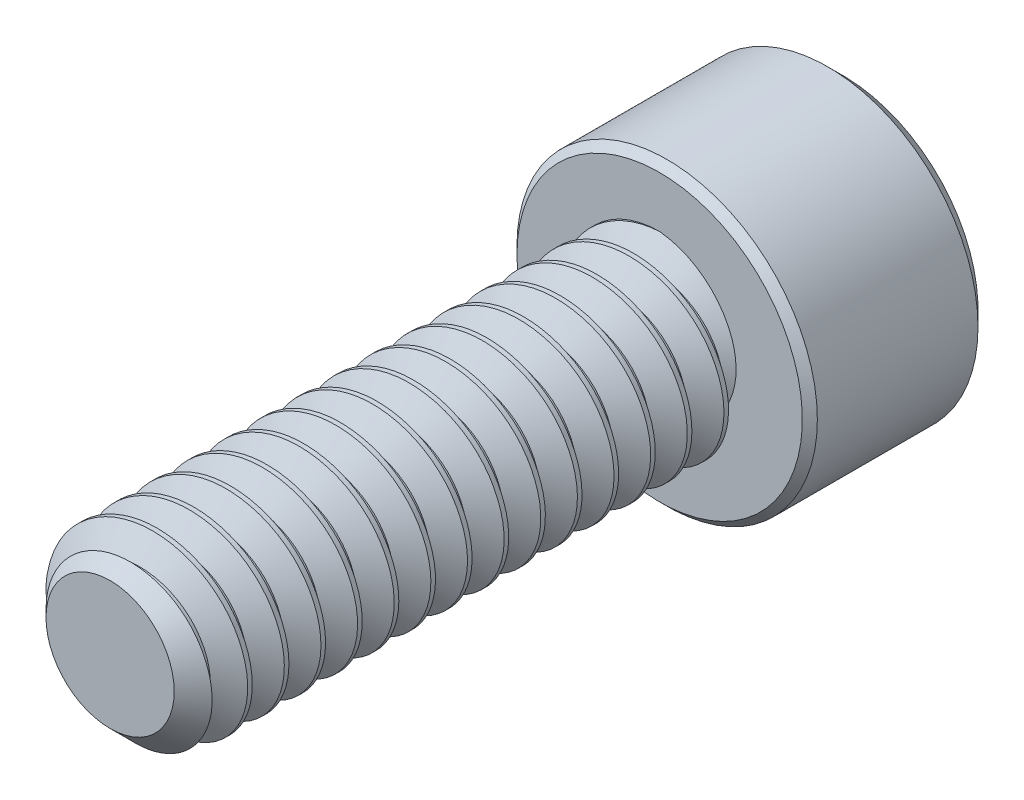
from build123d import *

# Parameters (mm, degrees)
SKETCH1_R          = 1.5875
EXTRUDE1_DEPTH     = 9.525
CHAMFER3_SIZE      = 0.47625
CUT_SWEEP1_PITCH   = 0.635
SKETCH6_R          = 2.6035
EXTRUDE2_DEPTH     = 3.175
CUT_EXTRUDE1_DEPTH = 1.7859375
CHAMFER1_SIZE      = 0.26035
CHAMFER2_SIZE      = 0.130175


with BuildPart() as part:
    # Sketch1 → Extrude1 (new body)
    with BuildSketch(Plane.XY):
        Circle(SKETCH1_R)
    extrude(amount=-EXTRUDE1_DEPTH)

    # Chamfer3
    chamfer3_edges = [part.edges().sort_by_distance(p)[0] for p in [
        (-1.5875, 0, 0),
    ]]
    chamfer(chamfer3_edges, length=CHAMFER3_SIZE)

    # Cut-Sweep1: the profile of Sketch3 profile screwed along a right-hand helix of 16 turns, 6 arcs to a turn; built about Z, then put on its axis
    cut_sweep1_z = Axis((0, 0, 0), (0, 0, 1))
    cut_sweep1_corners = [(1.5878, 0, -0.555798205), (1.175055401, 0, -0.3175), (1.175055401, 0, -0.238125), (1.5878, 0, 0.000173205)]
    with BuildLine(mode=Mode.PRIVATE) as cut_sweep1_profile:
        Line(cut_sweep1_corners[0], cut_sweep1_corners[1])
        Line(cut_sweep1_corners[1], cut_sweep1_corners[2])
        Line(cut_sweep1_corners[2], cut_sweep1_corners[3])
        Line(cut_sweep1_corners[3], cut_sweep1_corners[0])
    cut_sweep1_cap = Face(cut_sweep1_profile.wire())
    cut_sweep1_turn_angles = [0, 30, 60, 90, 120, 150, 180, 210, 240, 270, 300, 330, 360]
    cut_sweep1_turn_weights = [1, 0.8660254037844387, 1, 0.8660254037844387, 1, 0.8660254037844387, 1, 0.8660254037844387, 1, 0.8660254037844387, 1, 0.8660254037844387, 1]
    cut_sweep1_turn_rails = [Edge.make_bspline([Vector(p[0], p[1], 0).rotate(cut_sweep1_z, cut_sweep1_turn_angles[k]) / cut_sweep1_turn_weights[k] + Vector(0, 0, p[2] + CUT_SWEEP1_PITCH * cut_sweep1_turn_angles[k] / 360) for k in range(13)], [0, 0, 0, 1, 1, 2, 2, 3, 3, 4, 4, 5, 5, 6, 6, 6], 2, cut_sweep1_turn_weights) for p in cut_sweep1_corners]
    cut_sweep1_turn_sides = [Face.make_surface_from_curves(cut_sweep1_turn_rails[p[0]], cut_sweep1_turn_rails[p[1]]) for p in [(0, 1), (1, 2), (2, 3), (3, 0)]]
    cut_sweep1 = Plane(origin=(0, 0, 0), x_dir=(0, 1, 0), z_dir=(0, 0, -1)) * Solid(Shell([*[p.moved(Location((0, 0, CUT_SWEEP1_PITCH * i))) for i in range(16) for p in cut_sweep1_turn_sides], cut_sweep1_cap, cut_sweep1_cap.rotate(cut_sweep1_z, 5760).moved(Location((0, 0, CUT_SWEEP1_PITCH * 5760 / 360)))]))
    add(cut_sweep1, mode=Mode.SUBTRACT)

    # Sketch6 → Extrude2 (add)
    with BuildSketch(Plane(origin=(0, 0, -9.525), x_dir=(-1, 0, 0), z_dir=(0, 0, -1))):
        Circle(SKETCH6_R)
    extrude(amount=EXTRUDE2_DEPTH)

    # Sketch7 → Cut-Extrude1 (cut)
    with BuildSketch(Plane(origin=(0, 0, -12.7), x_dir=(-1, 0, 0), z_dir=(0, 0, -1))):
        Polygon((0, 1.374815329), (-1.190625, 0.687407664), (-1.190625, -0.687407664), (0, -1.374815329), (1.190625, -0.687407664), (1.190625, 0.687407664), align=None)
    extrude(amount=-CUT_EXTRUDE1_DEPTH, mode=Mode.SUBTRACT)

    # Cut-Extrude2 cone 1 section (through the dimple's axis) → Cut-Extrude2 (revolve, cut)
    with BuildSketch(Plane(origin=(0, 0, -12.7), x_dir=(0, 1, 0), z_dir=(1, 0, 0))):
        Polygon((0, 0), (1.374815329, 0), (0, 1.374815329), align=None)
    revolve(axis=Axis((0, 0, -12.7), (0, 0, 1)), mode=Mode.SUBTRACT)

    # Chamfer1
    chamfer1_edges = [part.edges().sort_by_distance(p)[0] for p in [
        (2.6035, 0, -12.7),
    ]]
    chamfer(chamfer1_edges, length=CHAMFER1_SIZE)

    # Chamfer2
    chamfer2_edges = [part.edges().sort_by_distance(p)[0] for p in [
        (2.6035, 0, -9.525),
    ]]
    chamfer(chamfer2_edges, length=CHAMFER2_SIZE)


solid = part.part
